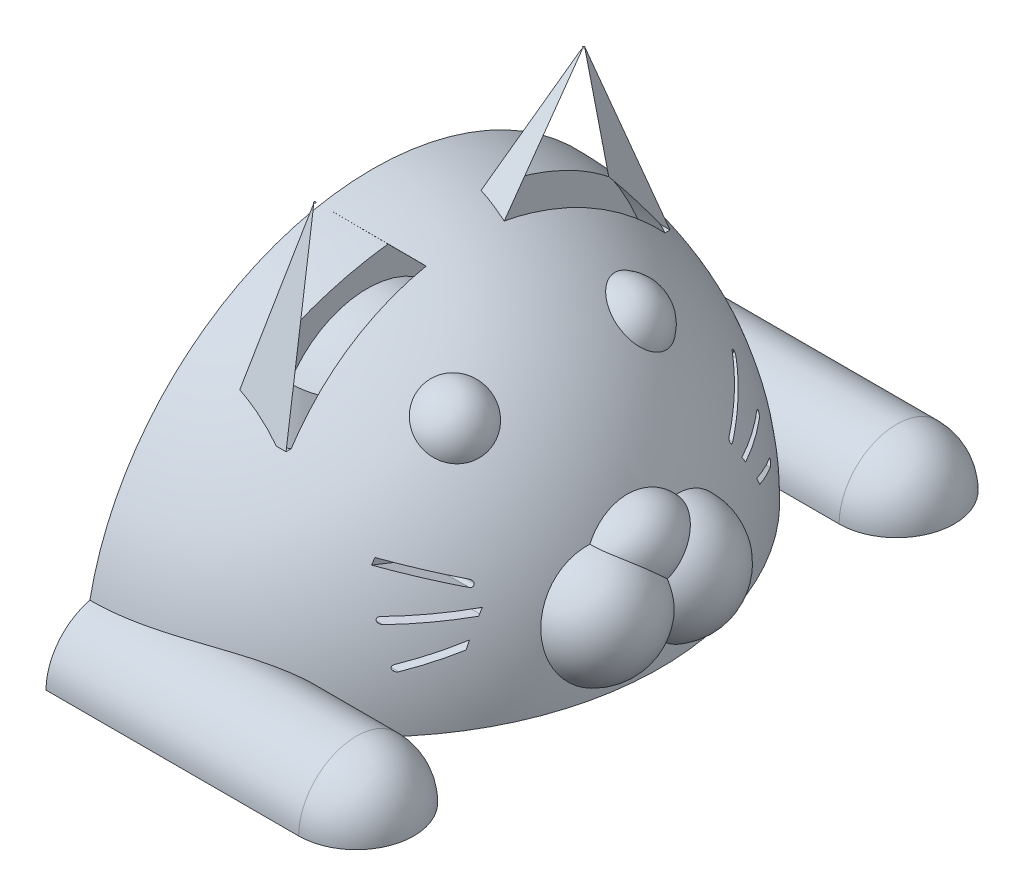
from build123d import *
from build123d.topology import SkipClean

# Parameters (mm, degrees)
REVOLUCI_N2_ANGLE            = 90
CORTAR_EXTRUIR1_DEPTH        = 3
REVOLUCI_N14_ANGLE           = 180
REVOLUCI_N15_ANGLE           = 180
SALIENTE_EXTRUIR1_DEPTH      = 2.5
SALIENTE_EXTRUIR1_DEPTH_BACK = 2.5


with BuildPart() as part:
    # Croquis3 → Revolución2 (revolve)
    with BuildSketch(Plane(origin=(0, 0, 0), x_dir=(1, 0, 0), z_dir=(0, 1, 0))):
        with BuildLine():
            Line((26.515836522, 15.273869353), (26.515836522, -14.726130647))
            ThreePointArc((26.515836522, -14.726130647), (41.515836522, 0.273869353), (26.515836522, 15.273869353))
        make_face()
    revolve(axis=Axis((26.515836522, 0, -15.273869353), (0, 0, 1)), revolution_arc=REVOLUCI_N2_ANGLE)

    # Croquis6 → Revolución6 (revolve)
    with SkipClean():  # the faces are left unmerged after this step: merging them gives an invalid solid
        with BuildSketch(Plane(origin=(0, 3, 0), x_dir=(1, 0, 0), z_dir=(0, 1, 0))):
            with BuildLine():
                Line((40.067099112, 5.273869353), (40.067099112, -0.726130647))
                ThreePointArc((40.067099112, -0.726130647), (43.067099112, 2.273869353), (40.067099112, 5.273869353))
            make_face()
        revolve(axis=Axis((40.067099112, 3, -5.273869353), (0, 0, 1)))

    # Croquis7 → Revolución8 (revolve)
    with BuildSketch(Plane(origin=(0, 3, 0), x_dir=(1, 0, 0), z_dir=(0, 1, 0))):
        with BuildLine():
            Line((40.00239204, 1.273869353), (40.00239204, -4.726130647))
            ThreePointArc((40.00239204, -4.726130647), (43.00239204, -1.726130647), (40.00239204, 1.273869353))
        make_face()
    revolve(axis=Axis((40.00239204, 3, -1.273869353), (0, 0, 1)))

    # Croquis9 → Revolución11 (revolve)
    with BuildSketch(Plane(origin=(0, 5, 0), x_dir=(1, 0, 0), z_dir=(0, 1, 0))):
        with BuildLine():
            Line((40.065836522, 3.102296477), (40.065836522, -2.554557772))
            ThreePointArc((40.065836522, -2.554557772), (42.065836522, 0.273869353), (40.065836522, 3.102296477))
        make_face()
    revolve(axis=Axis((40.065836522, 5, -3.102296477), (0, 0, 1)))

    # Recubrir1: read off the stored shape, not the designer's step
    # Recubrir1: loft between two sections, ruled curve by curve
    recubrir1_from = [
        Edge.make_bspline([(32.015836522, 10, 1.726130647), (32.015836522, 10, 0.726130647), (32.015836522, 10, -0.273869353), (32.015836522, 10, -2.273869353), (32.015836522, 10, -3.273869353), (32.015836522, 10, -5.273869353), (32.015836522, 10, -6.273869353), (32.015836522, 10, -8.273869353), (32.015836522, 10, -9.273869353), (32.015836522, 10, -10.273869353)], [0, 0, 0, 0, 0.25, 0.25, 0.5, 0.5, 0.75, 0.75, 1, 1, 1, 1], 3),
        Edge.make_bspline([(32.015836522, 10, -10.273869353), (31.515836522, 10, -10.273869353), (31.015836522, 10, -10.273869353), (30.015836522, 10, -10.273869353), (29.515836522, 10, -10.273869353), (29.015836522, 10, -10.273869353)], [0, 0, 0, 0, 0.5, 0.5, 1, 1, 1, 1], 3),
        Edge.make_bspline([(29.015836522, 10, 1.726130647), (29.515836522, 10, 1.726130647), (30.015836522, 10, 1.726130647), (31.015836522, 10, 1.726130647), (31.515836522, 10, 1.726130647), (32.015836522, 10, 1.726130647)], [0, 0, 0, 0, 0.5, 0.5, 1, 1, 1, 1], 3),
        Edge.make_bspline([(29.015836522, 10, -10.273869353), (29.015836522, 10, -9.273869353), (29.015836522, 10, -8.273869353), (29.015836522, 10, -6.273869353), (29.015836522, 10, -5.273869353), (29.015836522, 10, -3.273869353), (29.015836522, 10, -2.273869353), (29.015836522, 10, -0.273869353), (29.015836522, 10, 0.726130647), (29.015836522, 10, 1.726130647)], [0, 0, 0, 0, 0.25, 0.25, 0.5, 0.5, 0.75, 0.75, 1, 1, 1, 1], 3),
    ]
    recubrir1_to = [
        Edge.make_bspline([(30.527963303, 19, -7.225362228), (30.53580644, 19, -7.227323012), (30.544961162, 19, -7.231688021), (30.560262288, 19, -7.248298653), (30.565836522, 19, -7.260856413), (30.565836522, 19, -7.286882293), (30.560262288, 19, -7.299440053), (30.544961162, 19, -7.316050684), (30.53580644, 19, -7.320415693), (30.527963303, 19, -7.322376478)], [0, 0, 0, 0, 0.25, 0.25, 0.5, 0.5, 0.75, 0.75, 1, 1, 1, 1], 3),
        Edge.make_bspline([(30.527963303, 19, -7.322376478), (30.524041734, 19, -7.32335687), (30.519939128, 19, -7.323847066), (30.511733915, 19, -7.323847066), (30.507631309, 19, -7.32335687), (30.50370974, 19, -7.322376478)], [0, 0, 0, 0, 0.5, 0.5, 1, 1, 1, 1], 3),
        Edge.make_bspline([(30.50370974, 19, -7.225362228), (30.507631309, 19, -7.224381836), (30.511733915, 19, -7.223891639), (30.519939128, 19, -7.223891639), (30.524041734, 19, -7.224381836), (30.527963303, 19, -7.225362228)], [0, 0, 0, 0, 0.5, 0.5, 1, 1, 1, 1], 3),
        Edge.make_bspline([(30.50370974, 19, -7.322376478), (30.495866603, 19, -7.320415693), (30.486711881, 19, -7.316050684), (30.471410756, 19, -7.299440053), (30.465836522, 19, -7.286882293), (30.465836522, 19, -7.260856413), (30.471410756, 19, -7.248298653), (30.486711881, 19, -7.231688021), (30.495866603, 19, -7.227323012), (30.50370974, 19, -7.225362228)], [0, 0, 0, 0, 0.25, 0.25, 0.5, 0.5, 0.75, 0.75, 1, 1, 1, 1], 3),
    ]
    recubrir1 = Solid(Shell([*[Face.make_surface_from_curves(recubrir1_from[k], recubrir1_to[k]) for k in range(4)], Face(Wire(recubrir1_from)), Face(Wire(recubrir1_to))]))
    add(recubrir1)

    # Recubrir2: read off the stored shape, not the designer's step
    # Recubrir2: loft between two sections, ruled curve by curve
    recubrir2_from = [
        Edge.make_bspline([(32.015836522, 10, 9.726130647), (32.015836522, 10, 8.726130647), (32.015836522, 10, 7.726130647), (32.015836522, 10, 5.726130647), (32.015836522, 10, 4.726130647), (32.015836522, 10, 2.726130647), (32.015836522, 10, 1.726130647), (32.015836522, 10, -0.273869353), (32.015836522, 10, -1.273869353), (32.015836522, 10, -2.273869353)], [0, 0, 0, 0, 0.25, 0.25, 0.5, 0.5, 0.75, 0.75, 1, 1, 1, 1], 3),
        Edge.make_bspline([(32.015836522, 10, -2.273869353), (31.515836522, 10, -2.273869353), (31.015836522, 10, -2.273869353), (30.015836522, 10, -2.273869353), (29.515836522, 10, -2.273869353), (29.015836522, 10, -2.273869353)], [0, 0, 0, 0, 0.5, 0.5, 1, 1, 1, 1], 3),
        Edge.make_bspline([(29.015836522, 10, 9.726130647), (29.515836522, 10, 9.726130647), (30.015836522, 10, 9.726130647), (31.015836522, 10, 9.726130647), (31.515836522, 10, 9.726130647), (32.015836522, 10, 9.726130647)], [0, 0, 0, 0, 0.5, 0.5, 1, 1, 1, 1], 3),
        Edge.make_bspline([(29.015836522, 10, -2.273869353), (29.015836522, 10, -1.273869353), (29.015836522, 10, -0.273869353), (29.015836522, 10, 1.726130647), (29.015836522, 10, 2.726130647), (29.015836522, 10, 4.726130647), (29.015836522, 10, 5.726130647), (29.015836522, 10, 7.726130647), (29.015836522, 10, 8.726130647), (29.015836522, 10, 9.726130647)], [0, 0, 0, 0, 0.25, 0.25, 0.5, 0.5, 0.75, 0.75, 1, 1, 1, 1], 3),
    ]
    recubrir2_to = [
        Edge.make_bspline([(30.527963303, 19, 6.774637772), (30.53580644, 19, 6.772676988), (30.544961162, 19, 6.768311979), (30.560262288, 19, 6.751701347), (30.565836522, 19, 6.739143587), (30.565836522, 19, 6.713117707), (30.560262288, 19, 6.700559947), (30.544961162, 19, 6.683949316), (30.53580644, 19, 6.679584307), (30.527963303, 19, 6.677623522)], [0, 0, 0, 0, 0.25, 0.25, 0.5, 0.5, 0.75, 0.75, 1, 1, 1, 1], 3),
        Edge.make_bspline([(30.527963303, 19, 6.677623522), (30.524041734, 19, 6.67664313), (30.519939128, 19, 6.676152934), (30.511733915, 19, 6.676152934), (30.507631309, 19, 6.67664313), (30.50370974, 19, 6.677623522)], [0, 0, 0, 0, 0.5, 0.5, 1, 1, 1, 1], 3),
        Edge.make_bspline([(30.50370974, 19, 6.774637772), (30.507631309, 19, 6.775618164), (30.511733915, 19, 6.776108361), (30.519939128, 19, 6.776108361), (30.524041734, 19, 6.775618164), (30.527963303, 19, 6.774637772)], [0, 0, 0, 0, 0.5, 0.5, 1, 1, 1, 1], 3),
        Edge.make_bspline([(30.50370974, 19, 6.677623522), (30.495866603, 19, 6.679584307), (30.486711881, 19, 6.683949316), (30.471410756, 19, 6.700559947), (30.465836522, 19, 6.713117707), (30.465836522, 19, 6.739143587), (30.471410756, 19, 6.751701347), (30.486711881, 19, 6.768311979), (30.495866603, 19, 6.772676988), (30.50370974, 19, 6.774637772)], [0, 0, 0, 0, 0.25, 0.25, 0.5, 0.5, 0.75, 0.75, 1, 1, 1, 1], 3),
    ]
    recubrir2 = Solid(Shell([*[Face.make_surface_from_curves(recubrir2_from[k], recubrir2_to[k]) for k in range(4)], Face(Wire(recubrir2_from)), Face(Wire(recubrir2_to))]))
    add(recubrir2)

    # Croquis15 → Revolución12 (revolve)
    with SkipClean():  # the faces are left unmerged after this step: merging them gives an invalid solid
        with BuildSketch(Plane(origin=(0, 10, 0), x_dir=(1, 0, 0), z_dir=(0, 1, 0))):
            with BuildLine():
                Line((35.015836522, 6.773869353), (35.015836522, 2.773869353))
                ThreePointArc((35.015836522, 2.773869353), (37.015836522, 4.773869353), (35.015836522, 6.773869353))
            make_face()
        revolve(axis=Axis((35.015836522, 10, -6.773869353), (0, 0, 1)))

    # Croquis16 → Revolución13 (revolve)
    with SkipClean():  # the faces are left unmerged after this step: merging them gives an invalid solid
        with BuildSketch(Plane(origin=(0, 10, 0), x_dir=(1, 0, 0), z_dir=(0, 1, 0))):
            with BuildLine():
                Line((35.015836522, -2.226130647), (35.015836522, -6.226130647))
                ThreePointArc((35.015836522, -6.226130647), (37.015836522, -4.226130647), (35.015836522, -2.226130647))
            make_face()
        revolve(axis=Axis((35.015836522, 10, 2.226130647), (0, 0, 1)))

    # Croquis17 → Cortar-Extruir1 (cut)
    with SkipClean():  # the faces are left unmerged after this step: merging them gives an invalid solid
        with BuildSketch(Plane(origin=(39, 0, 0), x_dir=(0, 0, -1), z_dir=(1, 0, 0))):
            with BuildLine():
                Line((6.603242479, 5.910600458), (9.389276556, 7.023261287))
                ThreePointArc((9.389276556, 7.023261287), (9.584211301, 6.939592625), (9.500542639, 6.74465788))
                Line((9.500542639, 6.74465788), (6.714508562, 5.63199705))
                ThreePointArc((6.714508562, 5.63199705), (6.519573816, 5.715665713), (6.603242479, 5.910600458))
            make_face()
            with BuildLine():
                Line((6.548291617, 4.853701602), (9.548291617, 4.853701602))
                ThreePointArc((9.548291617, 4.853701602), (9.698291617, 4.703701602), (9.548291617, 4.553701602))
                Line((9.548291617, 4.553701602), (6.548291617, 4.553701602))
                ThreePointArc((6.548291617, 4.553701602), (6.398291617, 4.703701602), (6.548291617, 4.853701602))
            make_face()
            with BuildLine():
                Line((6.651673637, 3.869699471), (9.529612928, 3.022666157))
                ThreePointArc((9.529612928, 3.022666157), (9.631158227, 2.836417527), (9.444909597, 2.734872228))
                Line((9.444909597, 2.734872228), (6.566970306, 3.581905542))
                ThreePointArc((6.566970306, 3.581905542), (6.465425007, 3.768154172), (6.651673637, 3.869699471))
            make_face()
            with BuildLine():
                Line((-6.603242479, 5.910600458), (-9.389276556, 7.023261287))
                ThreePointArc((-9.389276556, 7.023261287), (-9.584211301, 6.939592625), (-9.500542639, 6.74465788))
                Line((-9.500542639, 6.74465788), (-6.714508562, 5.63199705))
                ThreePointArc((-6.714508562, 5.63199705), (-6.519573816, 5.715665713), (-6.603242479, 5.910600458))
            make_face()
            with BuildLine():
                Line((-6.548291617, 4.853701602), (-9.548291617, 4.853701602))
                ThreePointArc((-9.548291617, 4.853701602), (-9.698291617, 4.703701602), (-9.548291617, 4.553701602))
                Line((-9.548291617, 4.553701602), (-6.548291617, 4.553701602))
                ThreePointArc((-6.548291617, 4.553701602), (-6.398291617, 4.703701602), (-6.548291617, 4.853701602))
            make_face()
            with BuildLine():
                Line((-6.651673637, 3.869699471), (-9.529612928, 3.022666157))
                ThreePointArc((-9.529612928, 3.022666157), (-9.631158227, 2.836417527), (-9.444909597, 2.734872228))
                Line((-9.444909597, 2.734872228), (-6.566970306, 3.581905542))
                ThreePointArc((-6.566970306, 3.581905542), (-6.465425007, 3.768154172), (-6.651673637, 3.869699471))
            make_face()
        extrude(amount=-CORTAR_EXTRUIR1_DEPTH, mode=Mode.SUBTRACT)

    # Croquis18 → Revolución14 (revolve)
    with SkipClean():  # the faces are left unmerged after this step: merging them gives an invalid solid
        with BuildSketch(Plane(origin=(0, 0, 0), x_dir=(1, 0, 0), z_dir=(0, 1, 0))):
            with BuildLine():
                Line((28.358141258, -16.726130647), (39.673531786, -16.726130647))
                ThreePointArc((39.673531786, -16.726130647), (41.794852129, -15.847450991), (42.673531786, -13.726130647))
                Line((42.673531786, -13.726130647), (26.515836522, -13.726130647))
                Line((26.515836522, -13.726130647), (26.515836522, -16.726130647))
                Line((26.515836522, -16.726130647), (28.358141258, -16.726130647))
            make_face()
        revolve(axis=Axis((28.358141258, 0, 13.726130647), (-1, 0, 0)), revolution_arc=REVOLUCI_N14_ANGLE)

    # Croquis19 → Revolución15 (revolve)
    with SkipClean():  # the faces are left unmerged after this step: merging them gives an invalid solid
        with BuildSketch(Plane(origin=(0, 0, 0), x_dir=(1, 0, 0), z_dir=(0, 1, 0))):
            with BuildLine():
                Line((28.358141258, 11.416726496), (39.673531786, 11.416726496))
                ThreePointArc((39.673531786, 11.416726496), (41.794852129, 12.295406152), (42.673531786, 14.416726496))
                Line((42.673531786, 14.416726496), (26.515836522, 14.416726496))
                Line((26.515836522, 14.416726496), (26.515836522, 11.416726496))
                Line((26.515836522, 11.416726496), (28.358141258, 11.416726496))
            make_face()
        revolve(axis=Axis((28.358141258, 0, -14.416726496), (-1, 0, 0)), revolution_arc=REVOLUCI_N15_ANGLE)

    # Croquis34 → Cortar-Revolución1 (revolve, cut)
    with SkipClean():  # the faces are left unmerged after this step: merging them gives an invalid solid
        with BuildSketch(Plane(origin=(26.5, 0, 0), x_dir=(0, 0, -1), z_dir=(1, 0, 0))):
            with BuildLine():
                Line((-4.75, 5), (4.75, 5))
                ThreePointArc((4.75, 5), (0, 0.25), (-4.75, 5))
            make_face()
        revolve(axis=Axis((26.5, 5, 4.75), (0, 0, -1)), mode=Mode.SUBTRACT)

    # Croquis35 → Saliente-Extruir1 (add, two sides: drawn at the far end of the back side and taken through both)
    with SkipClean():  # the faces are left unmerged after this step: merging them gives an invalid solid
        with BuildSketch(Plane(origin=(0, 5, 0), x_dir=(1, 0, 0), z_dir=(0, 1, 0)).offset(-SALIENTE_EXTRUIR1_DEPTH_BACK)):
            with BuildLine():
                ThreePointArc((26.5, 5), (21.5, 0), (26.5, -5))
                ThreePointArc((26.5, -5), (31.5, 0), (26.5, 5))
            make_face()
            with BuildLine():
                ThreePointArc((26.5, 3.5), (23, 0), (26.5, -3.5))
                ThreePointArc((26.5, -3.5), (30, 0), (26.5, 3.5))
            make_face(mode=Mode.SUBTRACT)
        extrude(amount=SALIENTE_EXTRUIR1_DEPTH + SALIENTE_EXTRUIR1_DEPTH_BACK)


solid = part.part
